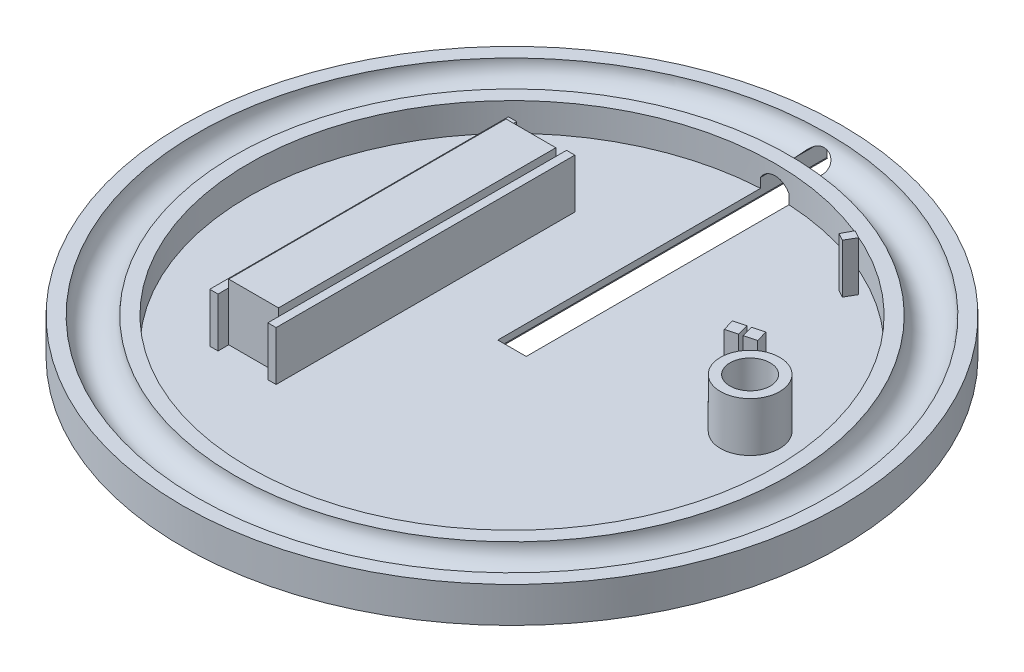
from build123d import *

# Parameters (mm, degrees)
SKETCH1_W                = 139
SKETCH1_H                = 15
SKETCH4_W                = 21
SKETCH4_H                = 117
BOSS_EXTRUDE1_DEPTH      = 12
SKETCH5_R                = 12.5
SKETCH5_R_2              = 8.5
BOSS_EXTRUDE2_DEPTH      = 8.8
BOSS_EXTRUDE3_DEPTH      = 8.8
SKETCH11_W               = 28
SKETCH11_H               = 126
SKETCH11_W_2             = 21
SKETCH11_H_2             = 117
BOSS_EXTRUDE5_DEPTH      = 8.8
CUT_EXTRUDE1_START       = -12
SKETCH13_R               = 111
SKETCH13_R_2             = 12.5
SKETCH13_W               = 28
SKETCH13_H               = 126
SKETCH13_R_3             = 8.5
CUT_EXTRUDE1_DEPTH       = 12
BOSS_EXTRUDE6_DEPTH      = 8.8
BOSS_EXTRUDE6_DEPTH_BACK = 12
SKETCH14_W               = 21
SKETCH14_H               = 4.5
CUT_EXTRUDE2_DEPTH       = 20.8
CUT_EXTRUDE3_START       = -139
CUT_EXTRUDE3_DEPTH       = 139


# Read off the part's stored shape, not the designer's step: Cut-Extrude3
with BuildPart() as part:
    # Sketch1 → Revolve1 (revolve)
    with BuildSketch(Plane.XY, mode=Mode.PRIVATE) as revolve1_sk:
        with Locations((69.5, 7.5)):
            Rectangle(SKETCH1_W, SKETCH1_H)
    revolve(revolve1_sk.sketch.rotate(Axis((0, 4.511025306, 0), (0, 1, 0)), 90), axis=Axis((0, 4.511025306, 0), (0, 1, 0)))

    # Sketch4 → Boss-Extrude1 (add)
    with BuildSketch(Plane(origin=(0, 15, 0), x_dir=(1, 0, 0), z_dir=(0, 1, 0))):
        with Locations((-50.5, 0)):
            Rectangle(SKETCH4_W, SKETCH4_H)
    extrude(amount=BOSS_EXTRUDE1_DEPTH)

    # Sketch5 → Boss-Extrude2 (add)
    with BuildSketch(Plane(origin=(0, 15, 0), x_dir=(1, 0, 0), z_dir=(0, 1, 0))):
        with Locations(Location((80.590940898, 19.851958221, 0), (0, 0, 270))):
            Circle(SKETCH5_R)
        with Locations(Location((80.590940898, 19.851958221, 0), (0, 0, 270))):
            Circle(SKETCH5_R_2, mode=Mode.SUBTRACT)
    extrude(amount=BOSS_EXTRUDE2_DEPTH)

    # Sketch9 → Boss-Extrude3 (add)
    with BuildSketch(Plane(origin=(0, 15, 0), x_dir=(1, 0, 0), z_dir=(0, 1, 0))):
        with BuildLine():
            Line((47.886099404, 90.060654472), (50.233457218, 94.475392436))
            ThreePointArc((50.233457218, 94.475392436), (51.874629366, 93.584308664), (53.5, 92.664718205))
            Line((53.5, 92.664718205), (51, 88.334591186))
            ThreePointArc((51, 88.334591186), (49.450581265, 89.211210128), (47.886099404, 90.060654472))
        make_face()
    extrude(amount=BOSS_EXTRUDE3_DEPTH)

    # Sketch11 → Boss-Extrude5 (add)
    with BuildSketch(Plane(origin=(0, 15, 0), x_dir=(1, 0, 0), z_dir=(0, 1, 0))):
        with Locations((-50.5, 0)):
            Rectangle(SKETCH11_W, SKETCH11_H)
        with Locations((-50.5, 0)):
            Rectangle(SKETCH11_W_2, SKETCH11_H_2, mode=Mode.SUBTRACT)
    extrude(amount=BOSS_EXTRUDE5_DEPTH)

    # Sketch13 → Cut-Extrude1 (cut)
    # profile 1 of 2: a face of its own
    with BuildSketch(Plane(origin=(0, 15, 0), x_dir=(1, 0, 0), z_dir=(0, 1, 0)).offset(CUT_EXTRUDE1_START)):
        with Locations(Location((0, 0, 0), (0, 0, 270))):
            Circle(SKETCH13_R)
        with Locations(Location((80.590940898, 19.851958221, 0), (0, 0, 90))):
            Circle(SKETCH13_R_2, mode=Mode.SUBTRACT)
        with BuildLine():
            ThreePointArc((50.233457218, 94.475392436), (51.874629366, 93.584308664), (53.5, 92.664718205))
            Line((53.5, 92.664718205), (51, 88.334591186))
            ThreePointArc((51, 88.334591186), (49.450581265, 89.211210128), (47.886099404, 90.060654472))
            Line((47.886099404, 90.060654472), (50.233457218, 94.475392436))
        make_face(mode=Mode.SUBTRACT)
        with Locations((-50.5, 0)):
            Rectangle(SKETCH13_W, SKETCH13_H, mode=Mode.SUBTRACT)
    # profile 2 of 2: a face of its own
    with BuildSketch(Plane(origin=(0, 15, 0), x_dir=(1, 0, 0), z_dir=(0, 1, 0)).offset(CUT_EXTRUDE1_START)):
        with Locations(Location((80.590940898, 19.851958221, 0), (0, 0, 90))):
            Circle(SKETCH13_R_3)
    extrude(amount=CUT_EXTRUDE1_DEPTH, mode=Mode.SUBTRACT)

    # Sketch12 → Boss-Extrude6 (add, two sides: drawn at the far end of the back side and taken through both)
    with BuildSketch(Plane(origin=(0, 15, 0), x_dir=(1, 0, 0), z_dir=(0, 1, 0)).offset(-BOSS_EXTRUDE6_DEPTH_BACK)):
        Polygon((64.928294207, 32.551017187), (63.606991435, 37.373273815), (68.429248063, 38.694576587), (69.750550835, 33.872319959), align=None)
        Polygon((63.481617219, 32.154626355), (62.160314446, 36.976882983), (57.338057819, 35.655580211), (58.659360591, 30.833323583), align=None)
    extrude(amount=BOSS_EXTRUDE6_DEPTH + BOSS_EXTRUDE6_DEPTH_BACK)

    # Sketch14 → Cut-Extrude2 (cut)
    with BuildSketch(Plane(origin=(0, 23.8, 0), x_dir=(1, 0, 0), z_dir=(0, 1, 0))):
        with Locations((-50.5, -60.75)):
            Rectangle(SKETCH14_W, SKETCH14_H)
        with Locations((-50.5, 60.75)):
            Rectangle(SKETCH14_W, SKETCH14_H)
    extrude(amount=-CUT_EXTRUDE2_DEPTH, mode=Mode.SUBTRACT)

    # Cut-Extrude3 outline → Cut-Extrude3 (cut)
    with BuildSketch(Plane.XY.offset(CUT_EXTRUDE3_START)):
        with BuildLine():
            ThreePointArc((5.848066516, 0), (5.925428493, 0.127755535), (6, 0.257159717))
            Line((6, 0.257159717), (6, 7))
            ThreePointArc((6, 7), (0, 10.510910407), (-6, 7))
            Line((-6, 7), (-6, 0.257159717))
            ThreePointArc((-6, 0.257159717), (-5.925428493, 0.127755535), (-5.848066516, 0))
            Line((-5.848066516, 0), (5.848066516, 0))
        make_face()
    extrude(amount=CUT_EXTRUDE3_DEPTH, mode=Mode.SUBTRACT)

    # Sketch2 → Cut-Revolve1 (revolve, cut)
    with BuildSketch(Plane.XY, mode=Mode.PRIVATE) as cut_revolve1_sk:
        with BuildLine():
            Line((117, 15), (133, 15))
            ThreePointArc((133, 15), (125, 7), (117, 15))
        make_face()
    revolve(cut_revolve1_sk.sketch.rotate(Axis((0, 15, 0), (0, 1, 0)), 270), axis=Axis((0, 15, 0), (0, 1, 0)), mode=Mode.SUBTRACT)


solid = part.part
